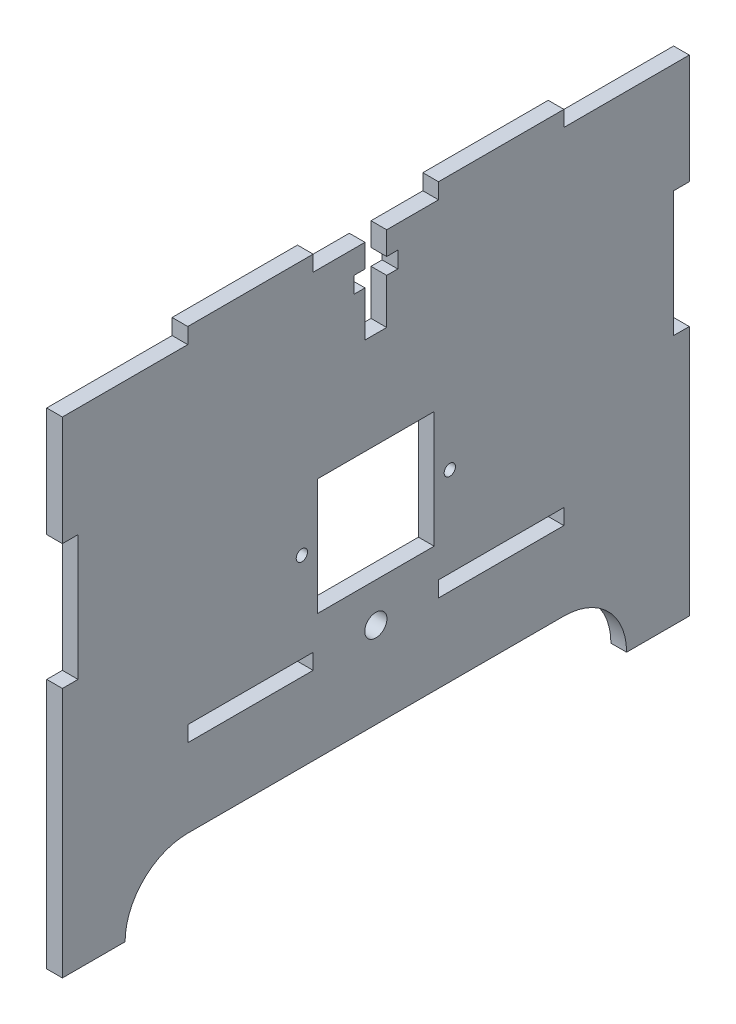
from build123d import *

# Parameters (mm, degrees)
SKETCH1_W                 = 127
SKETCH1_H                 = 101.6
BOSS_EXTRUDE1_DEPTH       = 3.175
SKETCH2_W                 = 25.4
SKETCH2_H                 = 3.175
CUT_EXTRUDE1_DEPTH        = 6.35
LPATTERN1_COUNT           = 3
LPATTERN1_PITCH           = 50.8
CUT_EXTRUDE4_DEPTH        = 6.35
SKETCH8_W                 = 3.175
SKETCH8_H                 = 25.4
CUT_EXTRUDE6_DEPTH        = 6.35
SKETCH9_W                 = 25.4
SKETCH9_H                 = 3.175
CUT_EXTRUDE7_DEPTH        = 6.35
LPATTERN6_COUNT           = 2
LPATTERN6_PITCH           = 50.8
SKETCH16_W                = 4.3942
SKETCH16_H                = 17.145
SKETCH16_W_2              = 8.89
SKETCH16_H_2              = 3.302
CUT_EXTRUDE14_DEPTH       = 6.35
F_8_CLEARANCE_HOLE1_D     = 4.4958
F_8_CLEARANCE_HOLE1_DEPTH = 10.16
F_8_CLEARANCE_HOLE1_TIP   = 1.350674586
SKETCH20_R                = 1.143
SKETCH20_W                = 23.622
SKETCH20_H                = 23.622
CUT_EXTRUDE16_DEPTH       = 10.16


with BuildPart() as part:
    # Sketch1 → Boss-Extrude1 (new body)
    with BuildSketch(Plane(origin=(0, 0, 0), x_dir=(0, 0, -1), z_dir=(1, 0, 0))):
        Rectangle(SKETCH1_W, SKETCH1_H)
    extrude(amount=BOSS_EXTRUDE1_DEPTH)

    # Sketch2 → Cut-Extrude1 (cut)
    with BuildSketch(Plane(origin=(3.175, 0, 0), x_dir=(0, 0, -1), z_dir=(1, 0, 0))):
        with Locations((-50.8, 49.2125)):
            Rectangle(SKETCH2_W, SKETCH2_H)
    cut_extrude1 = extrude(amount=-CUT_EXTRUDE1_DEPTH, mode=Mode.SUBTRACT)

    # LPattern1: Cut-Extrude1 ×3
    with Locations(*[(0, 0, -i * LPATTERN1_PITCH) for i in range(1, LPATTERN1_COUNT)]):
        add(cut_extrude1, mode=Mode.SUBTRACT)

    # Sketch5 → Cut-Extrude4 (cut)
    with BuildSketch(Plane(origin=(3.175, 0, 0), x_dir=(0, 0, -1), z_dir=(1, 0, 0))):
        with BuildLine():
            Line((-38.1, -38.1), (38.1, -38.1))
            ThreePointArc((38.1, -38.1), (50.8, -50.8), (38.1, -63.5))
            Line((38.1, -63.5), (-38.1, -63.5))
            ThreePointArc((-38.1, -63.5), (-50.8, -50.8), (-38.1, -38.1))
        make_face()
    extrude(amount=-CUT_EXTRUDE4_DEPTH, mode=Mode.SUBTRACT)

    # Sketch8 → Cut-Extrude6 (cut)
    with BuildSketch(Plane(origin=(3.175, 0, 0), x_dir=(0, 0, -1), z_dir=(1, 0, 0))):
        with Locations((61.9125, 12.7)):
            Rectangle(SKETCH8_W, SKETCH8_H)
    cut_extrude6 = extrude(amount=-CUT_EXTRUDE6_DEPTH, mode=Mode.SUBTRACT)

    # Sketch9 → Cut-Extrude7 (cut)
    with BuildSketch(Plane.ZY):
        with Locations((-25.4, -20.6375)):
            Rectangle(SKETCH9_W, SKETCH9_H)
    cut_extrude7 = extrude(amount=-CUT_EXTRUDE7_DEPTH, mode=Mode.SUBTRACT)

    # LPattern6: Cut-Extrude7 ×2
    with Locations(*[(0, 0, i * LPATTERN6_PITCH) for i in range(1, LPATTERN6_COUNT)]):
        add(cut_extrude7, mode=Mode.SUBTRACT)

    # Sketch16 → Cut-Extrude14 (cut)
    with BuildSketch(Plane.ZY):
        with Locations((0, 39.0525)):
            Rectangle(SKETCH16_W, SKETCH16_H)
        with Locations((0, 41.275)):
            Rectangle(SKETCH16_W_2, SKETCH16_H_2)
    extrude(amount=-CUT_EXTRUDE14_DEPTH, mode=Mode.SUBTRACT)

    # #8 Clearance Hole1
    with Locations(Plane.ZY):
        with Locations((0, -20.6375)):
            Hole(F_8_CLEARANCE_HOLE1_D / 2, depth=F_8_CLEARANCE_HOLE1_DEPTH)
            with Locations((0, 0, -(F_8_CLEARANCE_HOLE1_DEPTH + F_8_CLEARANCE_HOLE1_TIP / 2))):  # 118° drill point
                Cone(0, F_8_CLEARANCE_HOLE1_D / 2, F_8_CLEARANCE_HOLE1_TIP, mode=Mode.SUBTRACT)

    # Sketch20 → Cut-Extrude16 (cut)
    with BuildSketch(Plane.ZY):
        with Locations((-14.986, -0.889)):
            Circle(SKETCH20_R)
        with Locations((14.986, -0.889)):
            Circle(SKETCH20_R)
        with Locations((0, -0.889)):
            Rectangle(SKETCH20_W, SKETCH20_H)
    extrude(amount=-CUT_EXTRUDE16_DEPTH, mode=Mode.SUBTRACT)

    # Mirror3: Cut-Extrude6 across plane
    add(cut_extrude6.mirror(Plane.XY), mode=Mode.SUBTRACT)


solid = part.part
